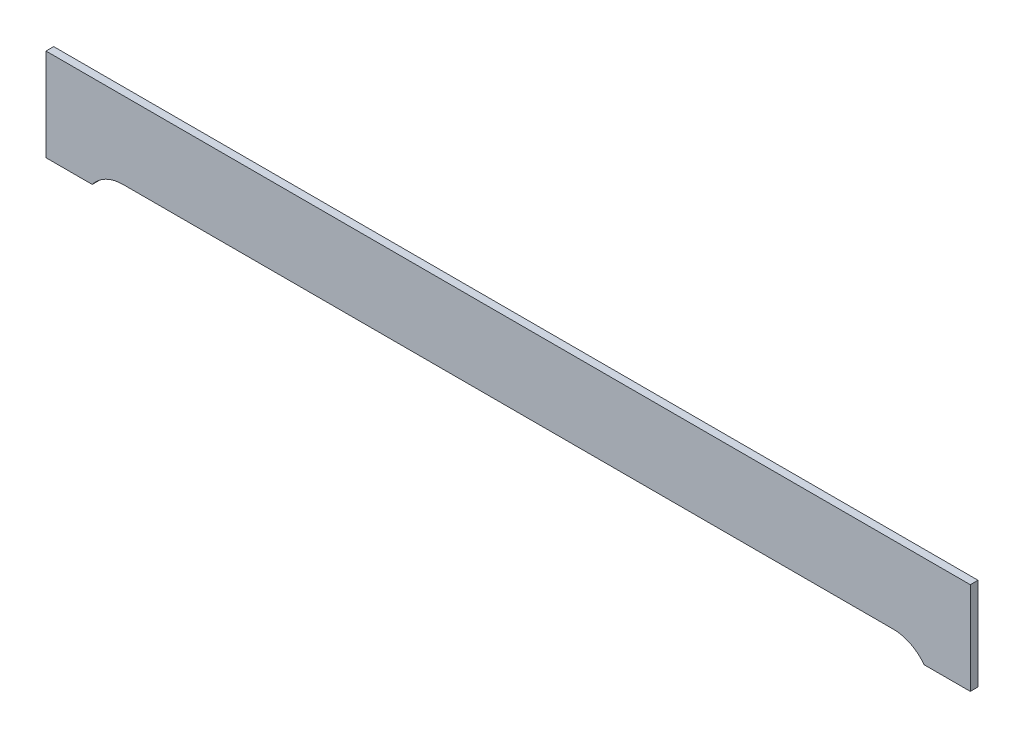
from build123d import *

# Parameters (mm, degrees)
BOSS_EXTRUDE1_DEPTH = 5


with BuildPart() as part:
    # Sketch1 → Boss-Extrude1 (new body)
    with BuildSketch(Plane.XY):
        with BuildLine():
            Line((0, 0), (0, -10))
            Line((0, -10), (30, -10))
            ThreePointArc((30, -10), (38.819660113, -2.639320225), (50, 0))
            Line((50, 0), (550, 0))
            ThreePointArc((550, 0), (561.180339887, -2.639320225), (570, -10))
            Line((570, -10), (600, -10))
            Line((600, -10), (600, 0))
            Line((600, 0), (600, 50))
            Line((600, 50), (0, 50))
            Line((0, 50), (0, 0))
        make_face()
    extrude(amount=BOSS_EXTRUDE1_DEPTH)


solid = part.part
